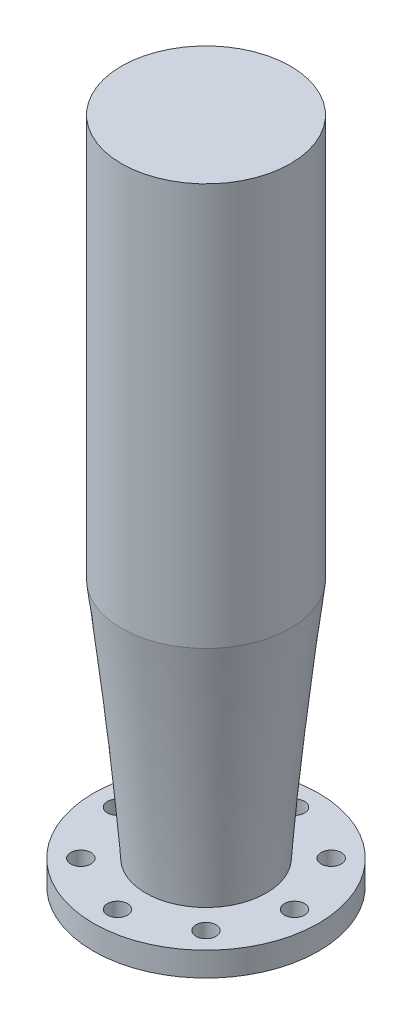
from build123d import *

# Parameters (mm, degrees)
ESBO_O1_R                = 14
ESBO_O1_R_2              = 1.25
RESSALTO_EXTRUS_O1_DEPTH = 3
ESBO_O4_R                = 10.5
RESSALTO_EXTRUS_O3_DEPTH = 50


with BuildPart() as part:
    # Esboço1 → Ressalto-extrusão1 (new body)
    with BuildSketch(Plane(origin=(0, 0, 0), x_dir=(1, 0, 0), z_dir=(0, 1, 0))):
        with Locations(Location((0, 0, 0), (0, 0, 270))):
            Circle(ESBO_O1_R)
        with Locations(Location((0, 11, 0), (0, 0, 270))):
            Circle(ESBO_O1_R_2, mode=Mode.SUBTRACT)
        with Locations(Location((7.778174593, 7.778174593, 0), (0, 0, 270))):
            Circle(ESBO_O1_R_2, mode=Mode.SUBTRACT)
        with Locations(Location((11, 0, 0), (0, 0, 270))):
            Circle(ESBO_O1_R_2, mode=Mode.SUBTRACT)
        with Locations(Location((7.778174593, -7.778174593, 0), (0, 0, 270))):
            Circle(ESBO_O1_R_2, mode=Mode.SUBTRACT)
        with Locations(Location((0, -11, 0), (0, 0, 270))):
            Circle(ESBO_O1_R_2, mode=Mode.SUBTRACT)
        with Locations(Location((-7.778174593, -7.778174593, 0), (0, 0, 270))):
            Circle(ESBO_O1_R_2, mode=Mode.SUBTRACT)
        with Locations(Location((-11, 0, 0), (0, 0, 270))):
            Circle(ESBO_O1_R_2, mode=Mode.SUBTRACT)
        with Locations(Location((-7.778174593, 7.778174593, 0), (0, 0, 270))):
            Circle(ESBO_O1_R_2, mode=Mode.SUBTRACT)
    extrude(amount=RESSALTO_EXTRUS_O1_DEPTH)

    # Loft1: read off the stored shape, not the designer's step
    # Loft1: loft between two sections, ruled curve by curve
    loft1_from = [
        Edge.make_bspline([(-7.155862372, 3, 2.245803579), (-2.664255213, 3, 16.557528323), (11.647469531, 3, 12.065921164), (7.155862372, 3, -2.245803579), (2.664255213, 3, -16.557528323), (-11.647469531, 3, -12.065921164), (-7.155862372, 3, 2.245803579)], [0, 0, 0, 0, 0.5, 0.5, 0.5, 1, 1, 1, 1], 3, [1, 0.333333333, 0.333333333, 1, 0.333333333, 0.333333333, 1]),
    ]
    loft1_to = [
        Edge.make_bspline([(-10.43066657, 33, -1.204655513), (-12.839977596, 33, 19.656677627), (8.021355544, 33, 22.065988653), (10.43066657, 33, 1.204655513), (12.839977596, 33, -19.656677627), (-8.021355544, 33, -22.065988653), (-10.43066657, 33, -1.204655513)], [0, 0, 0, 0, 0.5, 0.5, 0.5, 1, 1, 1, 1], 3, [1, 0.333333333, 0.333333333, 1, 0.333333333, 0.333333333, 1]),
    ]
    loft1 = Solid(Shell([*[Face.make_surface_from_curves(loft1_from[k], loft1_to[k]) for k in range(1)], Face(Wire(loft1_from)), Face(Wire(loft1_to))]))
    add(loft1)

    # Esboço4 → Ressalto-extrusão3 (add)
    with BuildSketch(Plane(origin=(0, 33, 0), x_dir=(1, 0, 0), z_dir=(0, 1, 0))):
        with Locations(Location((0, 0, 0), (0, 0, 173.412))):
            Circle(ESBO_O4_R)
    extrude(amount=RESSALTO_EXTRUS_O3_DEPTH)


solid = part.part
